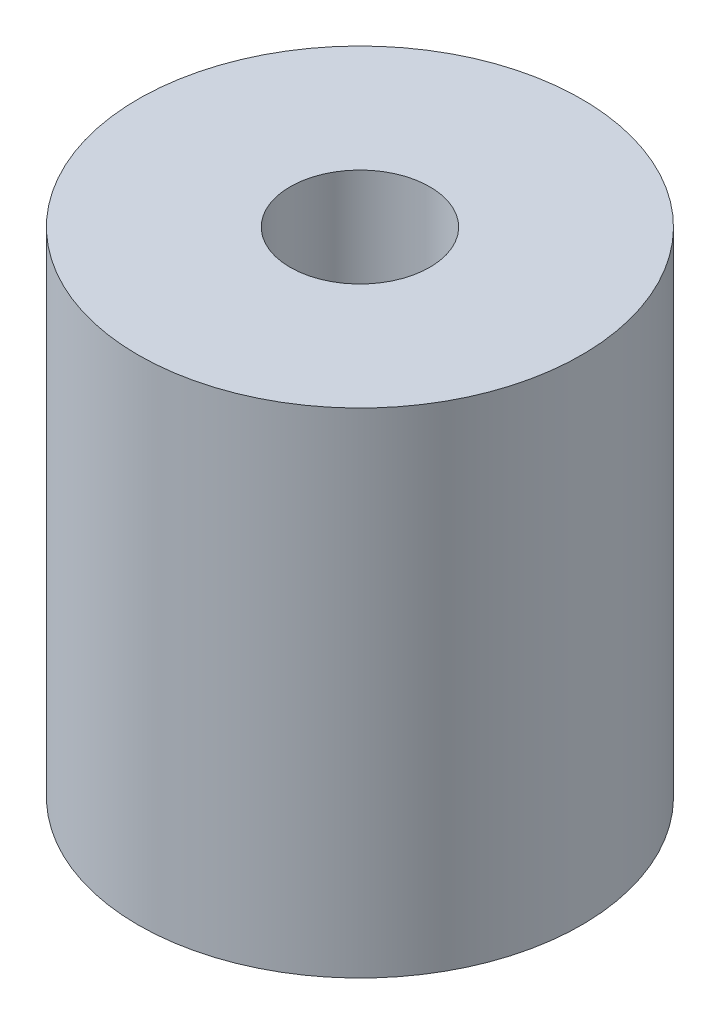
from build123d import *

# Parameters (mm, degrees)
SKETCH1_R           = 5
SKETCH1_R_2         = 1.575
BOSS_EXTRUDE1_DEPTH = 11.132


with BuildPart() as part:
    # Sketch1 → Boss-Extrude1 (new body)
    with BuildSketch(Plane(origin=(0, 0, 0), x_dir=(1, 0, 0), z_dir=(0, 1, 0))):
        Circle(SKETCH1_R)
        Circle(SKETCH1_R_2, mode=Mode.SUBTRACT)
    extrude(amount=BOSS_EXTRUDE1_DEPTH)


solid = part.part
